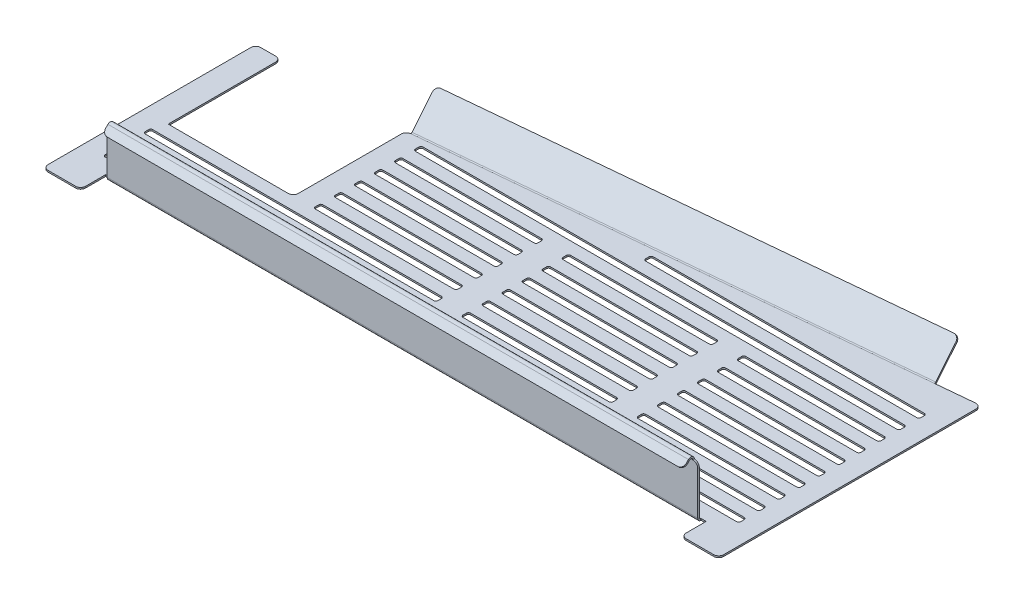
from build123d import *

# Parameters (mm, degrees)
VERTICAL_WALL_DEPTH   = 0.635
FILLET1_R             = 2
EDGE_FLANGE1_DEPTH    = 191.932131457
SKETCH8_W             = 240
SKETCH8_H             = 10
CUT_EXTRUDE1_DEPTH    = 10
EDGE_FLANGE3_DEPTH    = 236
BREAK_CORNER1_START   = -0.635
BREAK_CORNER1_DEPTH   = 0.635
BREAK_CORNER1_START_2 = -9.2634
BREAK_CORNER1_2_DEPTH = 0.635
SKETCH12_W            = 57
SKETCH12_H            = 3
SKETCH12_W_2          = 117
SKETCH12_W_3          = 60
SKETCH12_W_4          = 194
SKETCH12_W_5          = 110
CUT_EXTRUDE16_DEPTH   = 295.025925862
FILLET2_R             = 0.8
BREAK_CORNER2_START   = -56.661671948
BREAK_CORNER2_DEPTH   = 0.635
EDGE_FLANGE4_DEPTH    = 232
FILLET3_R             = 2


# Read off the part's stored shape, not the designer's step: Break-Corner1, Break-Corner2
# Sheet-metal steps are written as plain solids
with BuildPart() as part:
    # Sketch1 → Vertical Wall (new body)
    with BuildSketch(Plane(origin=(0, 0, 0), x_dir=(1, 0, 0), z_dir=(0, 1, 0))):
        Polygon((0, 0), (270, 0), (270, 105), (60, 85), (60, 40), (10, 40), (10, 85), (0, 85), (0, 40), align=None)
    extrude(amount=-VERTICAL_WALL_DEPTH)

    # Fillet1
    fillet1_edges = [part.edges().sort_by_distance(p)[0] for p in [
        (0, -0.3175, -85),
        (10, -0.3175, -85),
        (60, -0.3175, -40),
        (60, -0.3175, -85),
        (270, -0.3175, -105),
        (270, -0.3175, 0),
        (0, -0.3175, 0),
    ]]
    fillet(fillet1_edges, radius=FILLET1_R)

    # Edge-Flange1 section (across the edge) → Edge-Flange1 (add)
    with BuildSketch(Plane(origin=(252.849022551, 0, -103.67306388), x_dir=(0.06704015231539878, 0.7071067811865512, 0.7039215993116869), z_dir=(-0.9954954725939522, 0, 0.0948090926279955))):
        with BuildLine():
            Line((-0.635, 0.30510971), (-0.635, 15))
            Line((-0.635, 15), (0, 15))
            Line((0, 15), (0, 0.30510971))
            ThreePointArc((0, 0.30510971), (0.056070336, 0.023225094), (0.215745145, -0.215745145))
            Line((0.215745145, -0.215745145), (-0.233267661, -0.664757951))
            ThreePointArc((-0.233267661, -0.664757951), (-0.530593167, -0.219778886), (-0.635, 0.30510971))
        make_face()
    extrude(amount=EDGE_FLANGE1_DEPTH)

    # Sketch8 → Cut-Extrude1 (cut)
    with BuildSketch(Plane(origin=(0, 0, 0), x_dir=(1, 0, 0), z_dir=(0, 1, 0))):
        with Locations((135, 5)):
            Rectangle(SKETCH8_W, SKETCH8_H)
    extrude(amount=-CUT_EXTRUDE1_DEPTH, mode=Mode.SUBTRACT)

    # Edge-Flange3 section (across the edge) → Edge-Flange3 (add)
    with BuildSketch(Plane(origin=(17, 0, -9.2634), x_dir=(0, 0, -1), z_dir=(1, 0, 0))):
        with BuildLine():
            Line((-0.635, 0.7366), (-0.635, 20))
            Line((-0.635, 20), (0, 20))
            Line((0, 20), (0, 0.7366))
            ThreePointArc((0, 0.7366), (0.215745145, 0.215745145), (0.7366, 0))
            Line((0.7366, 0), (0.7366, -0.635))
            ThreePointArc((0.7366, -0.635), (-0.233267661, -0.233267661), (-0.635, 0.7366))
        make_face()
    extrude(amount=EDGE_FLANGE3_DEPTH)

    # Break-Corner1 outline → Break-Corner1 (cut)
    with BuildSketch(Plane(origin=(0, 0, 0), x_dir=(1, 0, 0), z_dir=(0, 1, 0)).offset(BREAK_CORNER1_START)):
        with BuildLine():
            Line((15, 0), (15, 2))
            ThreePointArc((15, 2), (14.414213562, 0.585786438), (13, 0))
            Line((13, 0), (15, 0))
        make_face()
        with BuildLine():
            Line((255, 0), (257, 0))
            ThreePointArc((257, 0), (255.585786438, 0.585786438), (255, 2))
            Line((255, 2), (255, 0))
        make_face()
    extrude(amount=BREAK_CORNER1_DEPTH, mode=Mode.SUBTRACT)

    # Break-Corner1 2 outline → Break-Corner1 2 (cut)
    with BuildSketch(Plane.XY.offset(BREAK_CORNER1_START_2)):
        with BuildLine():
            Line((17, 20), (17, 18))
            ThreePointArc((17, 18), (17.585786438, 19.414213562), (19, 20))
            Line((19, 20), (17, 20))
        make_face()
        with BuildLine():
            Line((253, 20), (251, 20))
            ThreePointArc((251, 20), (252.414213562, 19.414213562), (253, 18))
            Line((253, 18), (253, 20))
        make_face()
    extrude(amount=BREAK_CORNER1_2_DEPTH, mode=Mode.SUBTRACT)

    # Sketch12 → Cut-Extrude16 (cut, through all)
    with BuildSketch(Plane(origin=(0, 0, 0), x_dir=(1, 0, 0), z_dir=(0, 1, 0))):
        with Locations((96.5, 73.5)):
            Rectangle(SKETCH12_W, SKETCH12_H)
        with Locations((233.5, 73.5)):
            Rectangle(SKETCH12_W, SKETCH12_H)
        with Locations((96.5, 65.5)):
            Rectangle(SKETCH12_W, SKETCH12_H)
        with Locations((233.5, 65.5)):
            Rectangle(SKETCH12_W, SKETCH12_H)
        with Locations((96.5, 57.5)):
            Rectangle(SKETCH12_W, SKETCH12_H)
        with Locations((233.5, 57.5)):
            Rectangle(SKETCH12_W, SKETCH12_H)
        with Locations((96.5, 49.5)):
            Rectangle(SKETCH12_W, SKETCH12_H)
        with Locations((233.5, 49.5)):
            Rectangle(SKETCH12_W, SKETCH12_H)
        with Locations((96.5, 41.5)):
            Rectangle(SKETCH12_W, SKETCH12_H)
        with Locations((233.5, 41.5)):
            Rectangle(SKETCH12_W, SKETCH12_H)
        with Locations((66.5, 33.5)):
            Rectangle(SKETCH12_W_2, SKETCH12_H)
        with Locations((233.5, 33.5)):
            Rectangle(SKETCH12_W, SKETCH12_H)
        with Locations((66.5, 25.5)):
            Rectangle(SKETCH12_W_2, SKETCH12_H)
        with Locations((233.5, 25.5)):
            Rectangle(SKETCH12_W, SKETCH12_H)
        with Locations((165, 73.5)):
            Rectangle(SKETCH12_W_3, SKETCH12_H)
        with Locations((66.5, 17.5)):
            Rectangle(SKETCH12_W_2, SKETCH12_H)
        with Locations((233.5, 17.5)):
            Rectangle(SKETCH12_W, SKETCH12_H)
        with Locations((165, 65.5)):
            Rectangle(SKETCH12_W_3, SKETCH12_H)
        with Locations((165, 57.5)):
            Rectangle(SKETCH12_W_3, SKETCH12_H)
        with Locations((165, 49.5)):
            Rectangle(SKETCH12_W_3, SKETCH12_H)
        with Locations((165, 41.5)):
            Rectangle(SKETCH12_W_3, SKETCH12_H)
        with Locations((165, 33.5)):
            Rectangle(SKETCH12_W_3, SKETCH12_H)
        with Locations((165, 25.5)):
            Rectangle(SKETCH12_W_3, SKETCH12_H)
        with Locations((165, 17.5)):
            Rectangle(SKETCH12_W_3, SKETCH12_H)
        with Locations((165, 81.5)):
            Rectangle(SKETCH12_W_4, SKETCH12_H)
        with Locations((207, 89.5)):
            Rectangle(SKETCH12_W_5, SKETCH12_H)
    extrude(amount=-CUT_EXTRUDE16_DEPTH, mode=Mode.SUBTRACT)

    # Fillet2
    fillet2_edges = [part.edges().sort_by_distance(p)[0] for p in [
        (68, -0.3175, -72),
        (68, -0.3175, -75),
        (125, -0.3175, -75),
        (125, -0.3175, -72),
        (262, -0.3175, -72),
        (205, -0.3175, -72),
        (205, -0.3175, -75),
        (262, -0.3175, -75),
        (68, -0.3175, -64),
        (68, -0.3175, -67),
        (125, -0.3175, -67),
        (125, -0.3175, -64),
        (262, -0.3175, -64),
        (205, -0.3175, -64),
        (205, -0.3175, -67),
        (262, -0.3175, -67),
        (68, -0.3175, -56),
        (68, -0.3175, -59),
        (125, -0.3175, -59),
        (125, -0.3175, -56),
        (262, -0.3175, -56),
        (205, -0.3175, -56),
        (205, -0.3175, -59),
        (262, -0.3175, -59),
        (68, -0.3175, -48),
        (68, -0.3175, -51),
        (125, -0.3175, -51),
        (125, -0.3175, -48),
        (262, -0.3175, -48),
        (205, -0.3175, -48),
        (205, -0.3175, -51),
        (262, -0.3175, -51),
        (68, -0.3175, -40),
        (68, -0.3175, -43),
        (125, -0.3175, -43),
        (125, -0.3175, -40),
        (262, -0.3175, -40),
        (205, -0.3175, -40),
        (205, -0.3175, -43),
        (262, -0.3175, -43),
        (8, -0.3175, -32),
        (8, -0.3175, -35),
        (125, -0.3175, -35),
        (125, -0.3175, -32),
        (262, -0.3175, -32),
        (205, -0.3175, -32),
        (205, -0.3175, -35),
        (262, -0.3175, -35),
        (8, -0.3175, -24),
        (8, -0.3175, -27),
        (125, -0.3175, -27),
        (125, -0.3175, -24),
        (262, -0.3175, -24),
        (205, -0.3175, -24),
        (205, -0.3175, -27),
        (262, -0.3175, -27),
        (68, -0.3175, -80),
        (68, -0.3175, -83),
        (262, -0.3175, -83),
        (262, -0.3175, -80),
        (152, -0.3175, -88),
        (152, -0.3175, -91),
        (262, -0.3175, -91),
        (262, -0.3175, -88),
        (8, -0.3175, -16),
        (125, -0.3175, -19),
        (125, -0.3175, -16),
        (262, -0.3175, -16),
        (205, -0.3175, -16),
        (205, -0.3175, -19),
        (262, -0.3175, -19),
        (135, -0.3175, -72),
        (135, -0.3175, -75),
        (195, -0.3175, -75),
        (195, -0.3175, -72),
        (135, -0.3175, -64),
        (135, -0.3175, -67),
        (195, -0.3175, -67),
        (195, -0.3175, -64),
        (135, -0.3175, -56),
        (135, -0.3175, -59),
        (195, -0.3175, -59),
        (195, -0.3175, -56),
        (135, -0.3175, -48),
        (135, -0.3175, -51),
        (195, -0.3175, -51),
        (195, -0.3175, -48),
        (135, -0.3175, -40),
        (135, -0.3175, -43),
        (195, -0.3175, -43),
        (195, -0.3175, -40),
        (135, -0.3175, -32),
        (135, -0.3175, -35),
        (195, -0.3175, -35),
        (195, -0.3175, -32),
        (135, -0.3175, -24),
        (135, -0.3175, -27),
        (195, -0.3175, -27),
        (195, -0.3175, -24),
        (135, -0.3175, -16),
        (135, -0.3175, -19),
        (195, -0.3175, -19),
        (195, -0.3175, -16),
    ]]
    fillet(fillet2_edges, radius=FILLET2_R)

    # Break-Corner2 outline → Break-Corner2 (cut)
    with BuildSketch(Plane(origin=(0, 0, 0), x_dir=(0.9977502783650466, -0.047511433814558024, -0.04729741725883925), z_dir=(0.06704015231539881, 0.7071067811865511, 0.7039215993116871)).offset(BREAK_CORNER2_START)):
        with BuildLine():
            ThreePointArc((64.81177774, 73.547670097), (65.301217497, 74.998047453), (66.672875332, 75.677532946))
            Line((66.672875332, 75.677532946), (64.677395111, 75.543150318))
            Line((64.677395111, 75.543150318), (64.81177774, 73.547670097))
        make_face()
        with BuildLine():
            ThreePointArc((254.180300864, 88.304939814), (255.63067822, 87.815500057), (256.310163713, 86.443842222))
            Line((256.310163713, 86.443842222), (256.175781084, 88.439322442))
            Line((256.175781084, 88.439322442), (254.180300864, 88.304939814))
        make_face()
    extrude(amount=BREAK_CORNER2_DEPTH, mode=Mode.SUBTRACT)

    # Edge-Flange4 section (across the edge) → Edge-Flange4 (add)
    with BuildSketch(Plane(origin=(251, 21.77830971, -8.6284), x_dir=(0, -0.7071067811865488, -0.7071067811865464), z_dir=(-1, 0, 0))):
        with BuildLine():
            Line((-0.635, 1.77830971), (-0.635, 5))
            Line((-0.635, 5), (0, 5))
            Line((0, 5), (0, 1.77830971))
            ThreePointArc((0, 1.77830971), (0.454715384, 1.097780046), (1.257454855, 1.257454855))
            Line((1.257454855, 1.257454855), (1.706467661, 0.808442049))
            ThreePointArc((1.706467661, 0.808442049), (0.211711404, 0.511116543), (-0.635, 1.77830971))
        make_face()
    extrude(amount=EDGE_FLANGE4_DEPTH)

    # Fillet3
    fillet3_edges = [part.edges().sort_by_distance(p)[0] for p in [
        (251, 18.467282207, -4.868359691),
        (19, 18.467282207, -4.868359691),
    ]]
    fillet(fillet3_edges, radius=FILLET3_R)


solid = part.part
